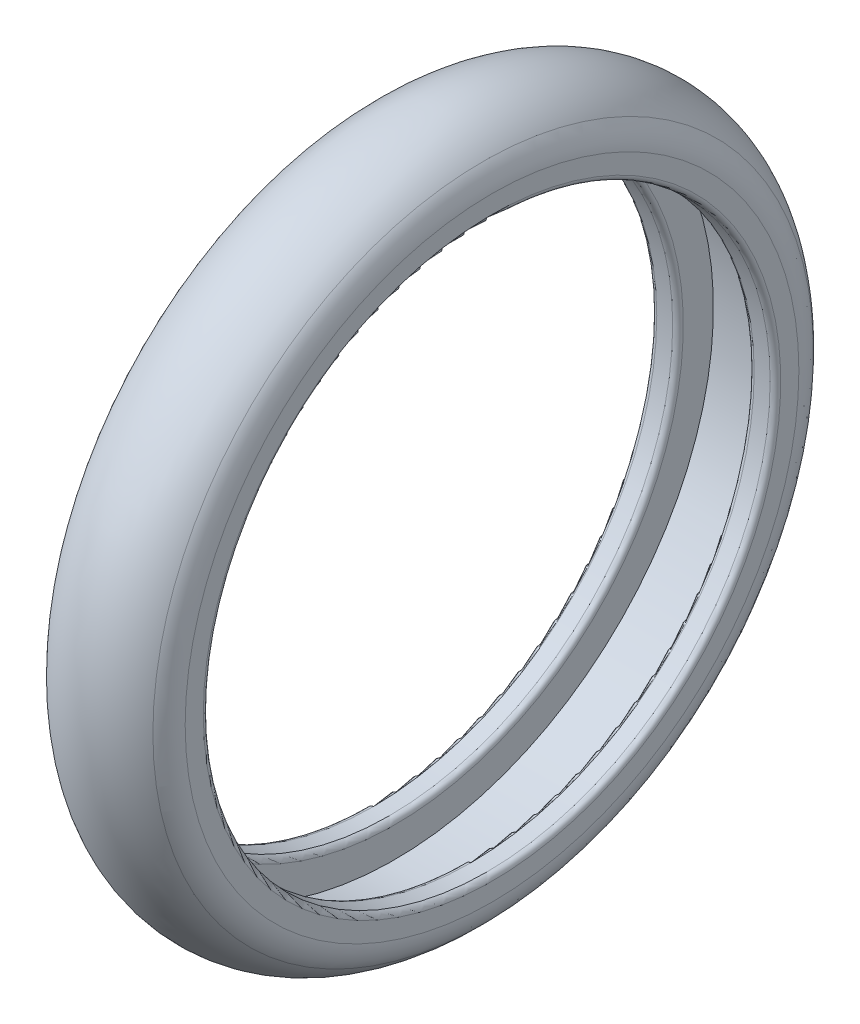
from build123d import *

# Parameters (mm, degrees)
VERRUNDUNG1_R = 2
VERRUNDUNG2_R = 0.3


with BuildPart() as part:
    # Skizze2 → Rotation1 (revolve)
    with BuildSketch(Plane.XY):
        with BuildLine():
            Line((2, 18), (-2, 18))
            Line((-2, 18), (-2, 16))
            Line((-2, 16), (-3.5, 16))
            Line((-3.5, 16), (-3.5, 17.936491673))
            ThreePointArc((-3.5, 17.936491673), (0, 20), (3.5, 17.936491673))
            Line((3.5, 17.936491673), (3.5, 16))
            Line((3.5, 16), (2, 16))
            Line((2, 16), (2, 18))
        make_face()
    revolve(axis=Axis((0, 0, 0), (1, 0, 0)))

    # Verrundung1
    verrundung1_edges = [part.edges().sort_by_distance(p)[0] for p in [
        (-3.5, -17.936491673, 0),
        (3.5, -17.936491673, 0),
    ]]
    fillet(verrundung1_edges, radius=VERRUNDUNG1_R)

    # Verrundung2
    verrundung2_edges = [part.edges().sort_by_distance(p)[0] for p in [
        (2, -16, 0),
        (-2, -16, 0),
        (-3.5, -16, 0),
        (3.5, -16, 0),
    ]]
    fillet(verrundung2_edges, radius=VERRUNDUNG2_R)


solid = part.part
